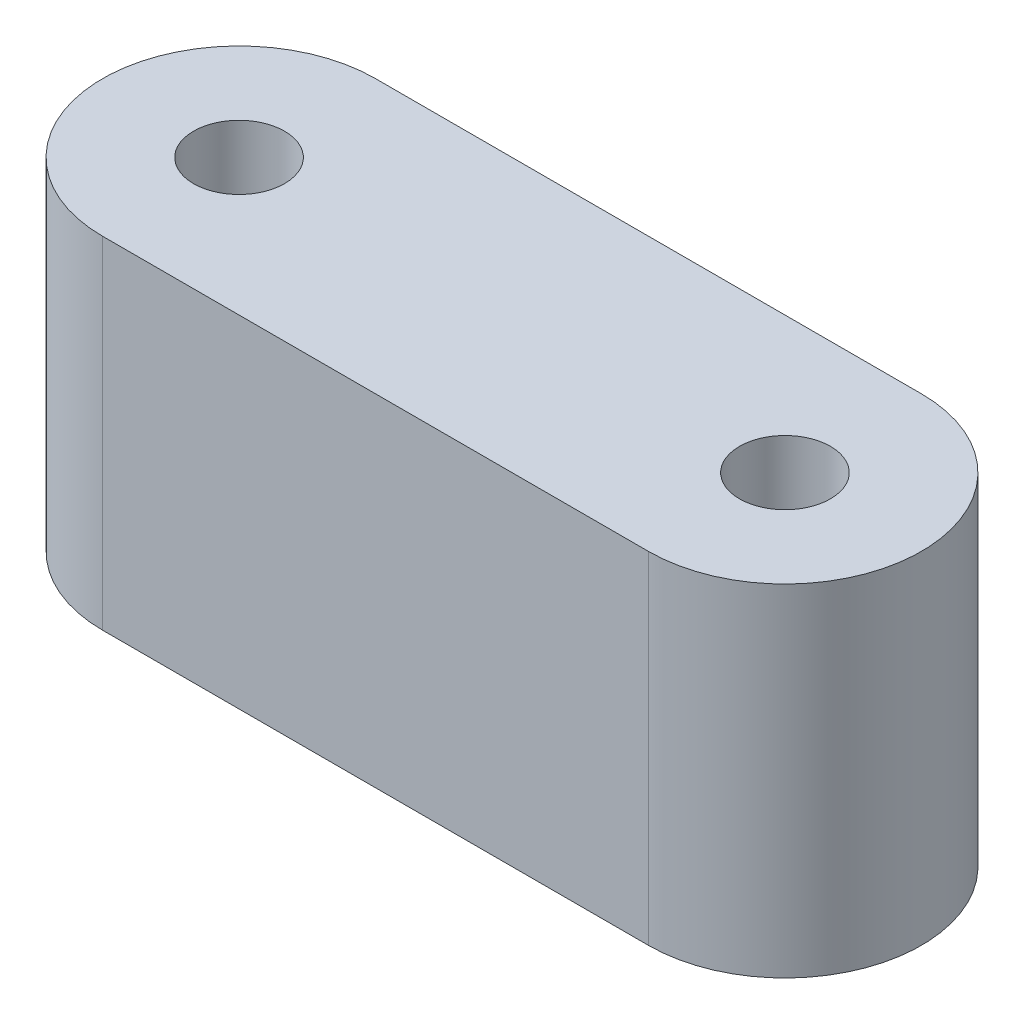
from build123d import *

# Parameters (mm, degrees)
SKETCH1_R           = 2
BOSS_EXTRUDE1_DEPTH = 15
CUT_EXTRUDE1_DEPTH  = 6


with BuildPart() as part:
    # Sketch1 → Boss-Extrude1 (new body)
    with BuildSketch(Plane(origin=(0, 0, 0), x_dir=(1, 0, 0), z_dir=(0, 1, 0))):
        with BuildLine():
            Line((-12, 6), (12, 6))
            ThreePointArc((12, 6), (18, 0), (12, -6))
            Line((12, -6), (-12, -6))
            ThreePointArc((-12, -6), (-18, 0), (-12, 6))
        make_face()
        with Locations((-12, 0)):
            Circle(SKETCH1_R, mode=Mode.SUBTRACT)
        with Locations((12, 0)):
            Circle(SKETCH1_R, mode=Mode.SUBTRACT)
    extrude(amount=BOSS_EXTRUDE1_DEPTH)

    # Sketch2 → Cut-Extrude1 (cut)
    with BuildSketch(Plane.XZ):
        Polygon((-13.833087105, 3.175), (-15.666174209, 0), (-13.833087105, -3.175), (-10.166912895, -3.175), (-8.333825791, 0), (-10.166912895, 3.175), align=None)
    cut_extrude1 = extrude(amount=-CUT_EXTRUDE1_DEPTH, mode=Mode.SUBTRACT)

    # Mirror1: Cut-Extrude1 across plane
    add(cut_extrude1.mirror(Plane(origin=(0, 0, 0), x_dir=(0, 0, 1), z_dir=(1, 0, 0))), mode=Mode.SUBTRACT)


solid = part.part
